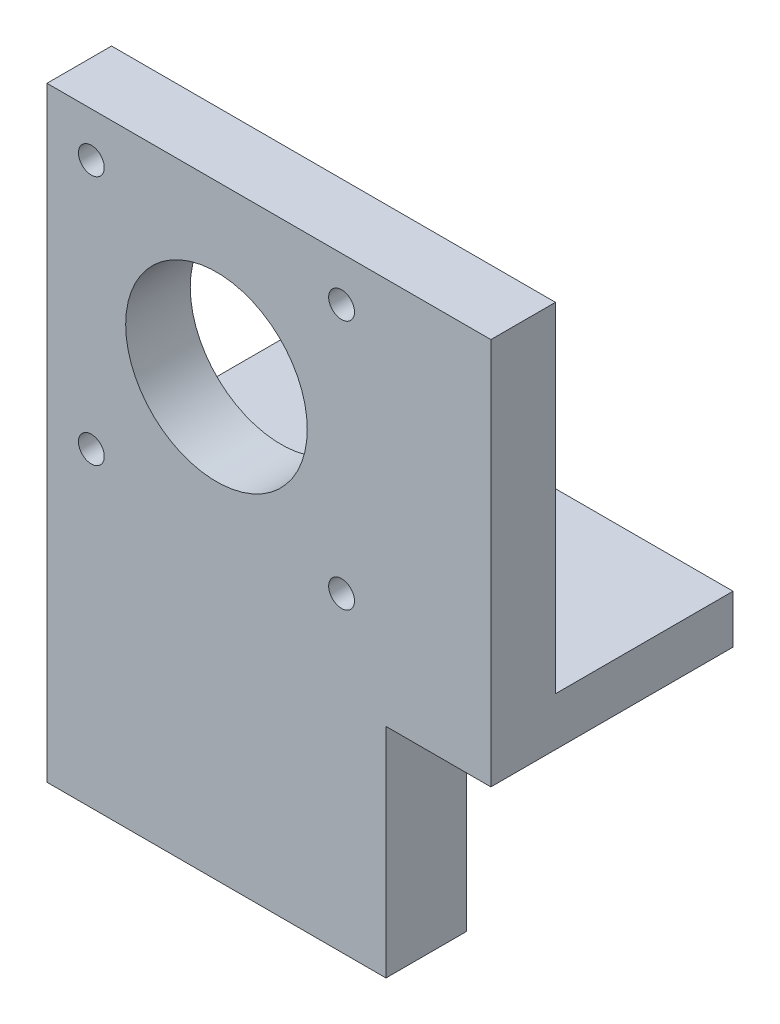
from build123d import *

# Parameters (mm, degrees)
SKETCH3_W                                       = 42
SKETCH3_H                                       = 30
BOSS_EXTRUDE1_DEPTH                             = 8
SKETCH4_W                                       = 42
SKETCH4_H                                       = 10
BOSS_EXTRUDE2_DEPTH                             = 25
CSK_FOR_M3_FLAT_HEAD_MACHINE_SCREW1_D           = 3.2
CSK_FOR_M3_FLAT_HEAD_MACHINE_SCREW1_CSINK_D     = 6.3
CSK_FOR_M3_FLAT_HEAD_MACHINE_SCREW1_CSINK_ANGLE = 90
SKETCH10_W                                      = 42
SKETCH10_H                                      = 8
BOSS_EXTRUDE3_DEPTH                             = 42
SKETCH11_R                                      = 11.25
CUT_EXTRUDE1_DEPTH                              = 42
M3_CLEARANCE_HOLE4_D                            = 3.2
BOSS_EXTRUDE4_DEPTH                             = 13
CHAMFER2_SIZE                                   = 2


with BuildPart() as part:
    # Sketch3 → Boss-Extrude1 (new body)
    with BuildSketch(Plane(origin=(0, 0, 0), x_dir=(1, 0, 0), z_dir=(0, 1, 0))):
        with Locations((0, -5)):
            Rectangle(SKETCH3_W, SKETCH3_H)
    extrude(amount=-BOSS_EXTRUDE1_DEPTH)

    # Sketch4 → Boss-Extrude2 (add)
    with BuildSketch(Plane.XZ.offset(8)):
        with Locations((0, 15)):
            Rectangle(SKETCH4_W, SKETCH4_H)
    extrude(amount=BOSS_EXTRUDE2_DEPTH)

    # CSK for M3 Flat Head Machine Screw1 (through all)
    with Locations(Plane(origin=(0, 0, 0), x_dir=(1, 0, 0), z_dir=(0, 1, 0))):
        with Locations((8, -7.5), (-8, -7.5), (8, 7.5), (-8, 7.5)):
            CounterSinkHole(CSK_FOR_M3_FLAT_HEAD_MACHINE_SCREW1_D / 2, CSK_FOR_M3_FLAT_HEAD_MACHINE_SCREW1_CSINK_D / 2, counter_sink_angle=CSK_FOR_M3_FLAT_HEAD_MACHINE_SCREW1_CSINK_ANGLE)

    # Sketch10 → Boss-Extrude3 (add)
    with BuildSketch(Plane(origin=(0, 0, 0), x_dir=(1, 0, 0), z_dir=(0, 1, 0))):
        with Locations((0, -16)):
            Rectangle(SKETCH10_W, SKETCH10_H)
    extrude(amount=BOSS_EXTRUDE3_DEPTH)

    # Sketch11 → Cut-Extrude1 (cut)
    with BuildSketch(Plane(origin=(0, 0, 12), x_dir=(-1, 0, 0), z_dir=(0, 0, -1))):
        with Locations((0, 21)):
            Circle(SKETCH11_R)
    extrude(amount=-CUT_EXTRUDE1_DEPTH, mode=Mode.SUBTRACT)

    # M3 Clearance Hole4 (through all)
    with Locations(Plane(origin=(0, 0, 12), x_dir=(-1, 0, 0), z_dir=(0, 0, -1))):
        with Locations((15.5, 5.5), (-15.5, 5.5), (15.5, 36.5), (-15.5, 36.5)):
            Hole(M3_CLEARANCE_HOLE4_D / 2)

    # Sketch14 → Boss-Extrude4 (add)
    with BuildSketch(Plane(origin=(21, 0, 0), x_dir=(0, 0, -1), z_dir=(1, 0, 0))):
        Polygon((10, 0), (-10, 0), (-12, 0), (-12, 42), (-20, 42), (-20, -6), (-12, -6), (-10, -6), (10, -6), align=None)
    extrude(amount=BOSS_EXTRUDE4_DEPTH)

    # Chamfer2
    chamfer2_edges = [part.edges().sort_by_distance(p)[0] for p in [
        (-21, -8, 0),
    ]]
    chamfer(chamfer2_edges, length=CHAMFER2_SIZE)


solid = part.part
